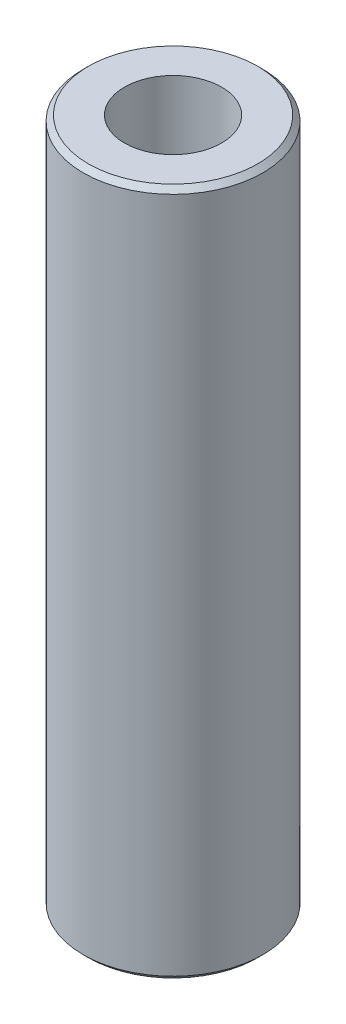
from build123d import *

# Parameters (mm, degrees)
SKETCH1_R           = 37.5
BOSS_EXTRUDE1_DEPTH = 287.096144619
SKETCH2_R           = 20.26811971
CUT_EXTRUDE1_DEPTH  = 292.953243268
CHAMFER1_SIZE       = 2.165803389


with BuildPart() as part:
    # Sketch1 → Boss-Extrude1 (new body)
    with BuildSketch(Plane(origin=(0, 0, 0), x_dir=(1, 0, 0), z_dir=(0, 1, 0))):
        Circle(SKETCH1_R)
    extrude(amount=BOSS_EXTRUDE1_DEPTH)

    # Sketch2 → Cut-Extrude1 (cut, through all)
    with BuildSketch(Plane(origin=(0, 0, 0), x_dir=(1, 0, 0), z_dir=(0, 1, 0))):
        Circle(SKETCH2_R)
    extrude(amount=CUT_EXTRUDE1_DEPTH, mode=Mode.SUBTRACT)

    # Chamfer1
    chamfer1_edges = [part.edges().sort_by_distance(p)[0] for p in [
        (-37.5, 287.096144619, 0),
        (-37.5, 0, 0),
    ]]
    chamfer(chamfer1_edges, length=CHAMFER1_SIZE)


solid = part.part
